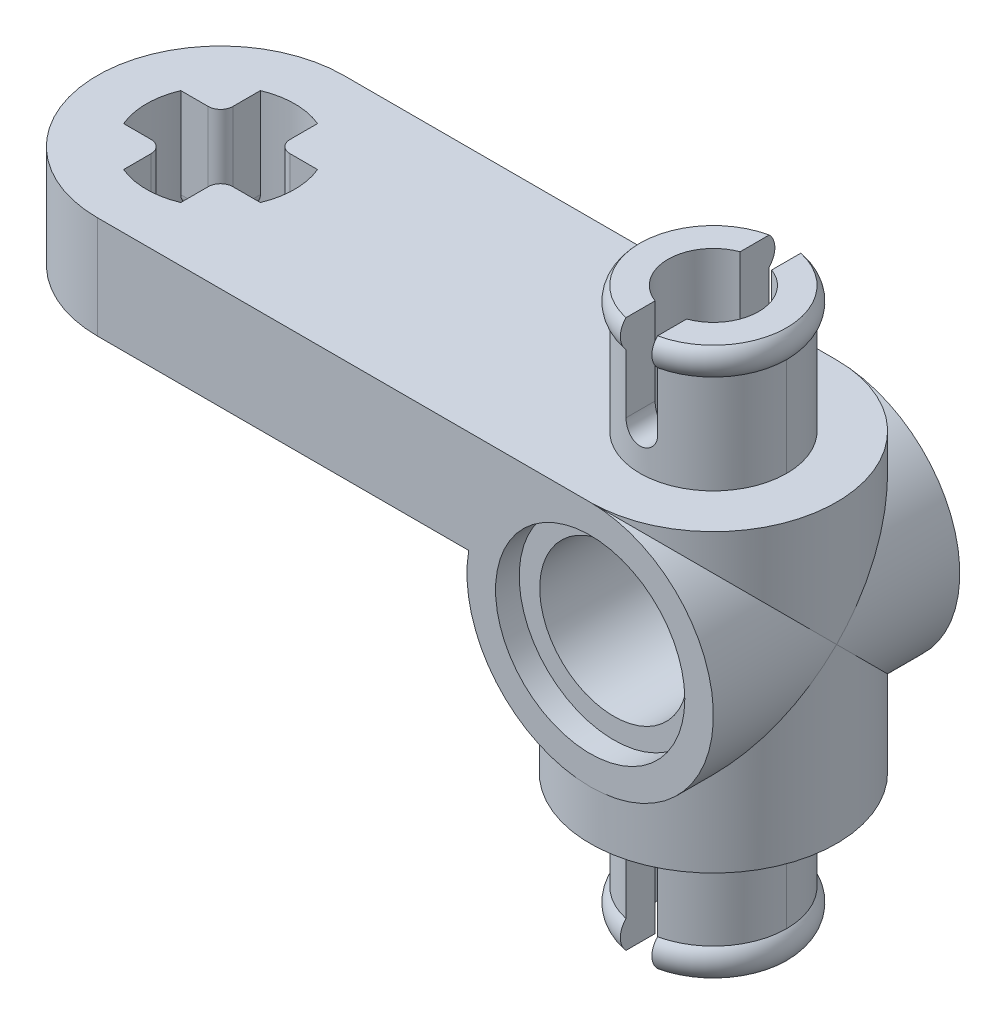
from build123d import *

# Parameters (mm, degrees)
BASE_EXTRUDE_DEPTH       = 1.651
CUT_EXTRUDE4_DEPTH       = 13.977402268
FILLET1_R                = 0.396875
SKETCH8_R                = 3.96875
BOSS_EXTRUDE1_DEPTH      = 9.525
BOSS_EXTRUDE2_DEPTH      = 3.96875
BOSS_EXTRUDE2_DEPTH_BACK = 3.96875
SKETCH9_R                = 3.96875
SKETCH13_R               = 2.3622
BOSS_EXTRUDE3_DEPTH      = 8.8265
CUT_EXTRUDE8_START       = 1.651
CUT_EXTRUDE8_OUTLINE_R   = 1.4605
CUT_EXTRUDE8_DEPTH       = 4.064
CUT_EXTRUDE10_DEPTH      = 18.321247346
CUT_EXTRUDE10_DEPTH_BACK = 18.321247346
CUT_EXTRUDE11_START      = -4.064
SKETCH19_R               = 1.4605
CUT_EXTRUDE11_DEPTH      = 4.064
SKETCH10_R               = 2.3876
CUT_EXTRUDE5_DEPTH       = 19.635410961
SKETCH11_R               = 3.048
CUT_EXTRUDE6_DEPTH       = 0.762
CUT_EXTRUDE7_START       = -0.762
SKETCH12_R               = 3.048
CUT_EXTRUDE7_DEPTH       = 0.762
SKETCH20_W               = 6.400057863
SKETCH20_H               = 4.7625
CUT_EXTRUDE12_DEPTH      = 2.032
BOSS_EXTRUDE4_REACH      = 18.228
SKETCH21_W               = 1.778
SKETCH21_H               = 1.143
SKETCH22_R               = 3.556
SKETCH22_R_2             = 2.3876
BOSS_EXTRUDE5_DEPTH      = 0.127
FILLET2_R                = 0.39624


# Read off the part's stored shape, not the designer's step: Cut-Extrude8
with BuildPart() as part:
    # Sketch1 → Base-Extrude (new, symmetric)
    with BuildSketch(Plane(origin=(0, 0, 0), x_dir=(1, 0, 0), z_dir=(0, 1, 0))):
        with BuildLine():
            Line((-7.9375, 3.96875), (7.9375, 3.96875))
            ThreePointArc((7.9375, 3.96875), (11.90625, 0), (7.9375, -3.96875))
            Line((7.9375, -3.96875), (-7.9375, -3.96875))
            ThreePointArc((-7.9375, -3.96875), (-11.90625, 0), (-7.9375, 3.96875))
        make_face()
    extrude(amount=BASE_EXTRUDE_DEPTH, both=True)

    # Sketch5 → Cut-Extrude4 (cut, through all)
    with BuildSketch(Plane(origin=(0, 1.651, 0), x_dir=(-1, 0, 0), z_dir=(0, 1, 0))):
        with BuildLine():
            Line((7.01675, -2.202919244), (7.01675, -0.92075))
            Line((7.01675, -0.92075), (5.734580756, -0.92075))
            ThreePointArc((5.734580756, -0.92075), (5.5499, 0), (5.734580756, 0.92075))
            Line((5.734580756, 0.92075), (7.01675, 0.92075))
            Line((7.01675, 0.92075), (7.01675, 2.202919244))
            ThreePointArc((7.01675, 2.202919244), (7.9375, 2.3876), (8.85825, 2.202919244))
            Line((8.85825, 2.202919244), (8.85825, 0.92075))
            Line((8.85825, 0.92075), (10.140419244, 0.92075))
            ThreePointArc((10.140419244, 0.92075), (10.3251, 0), (10.140419244, -0.92075))
            Line((10.140419244, -0.92075), (8.85825, -0.92075))
            Line((8.85825, -0.92075), (8.85825, -2.202919244))
            ThreePointArc((8.85825, -2.202919244), (7.9375, -2.3876), (7.01675, -2.202919244))
        make_face()
    extrude(amount=-CUT_EXTRUDE4_DEPTH, mode=Mode.SUBTRACT)

    # Fillet1
    fillet1_edges = [part.edges().sort_by_distance(p)[0] for p in [
        (-7.01675, 0, 0.92075),
        (-8.85825, 0, 0.92075),
        (-8.85825, 0, -0.92075),
        (-7.01675, 0, -0.92075),
    ]]
    fillet(fillet1_edges, radius=FILLET1_R)

    # Sketch8 → Boss-Extrude1 (add)
    with BuildSketch(Plane.XZ.offset(-1.651)):
        with Locations(Location((7.9375, 0, 0), (0, 0, 270))):
            Circle(SKETCH8_R)
    extrude(amount=BOSS_EXTRUDE1_DEPTH)

    # Sketch9 → Boss-Extrude2 (add, two sides: drawn at the far end of the back side and taken through both)
    with BuildSketch(Plane.XY.offset(-BOSS_EXTRUDE2_DEPTH_BACK)):
        with Locations((7.9375, -2.31775)):
            Circle(SKETCH9_R)
    extrude(amount=BOSS_EXTRUDE2_DEPTH + BOSS_EXTRUDE2_DEPTH_BACK)

    # Sketch13 → Boss-Extrude3 (add, symmetric)
    with BuildSketch(Plane(origin=(0, -3.1115, 0), x_dir=(-1, 0, 0), z_dir=(0, 1, 0))):
        with Locations(Location((-7.9375, 0, 0), (0, 0, 270))):
            Circle(SKETCH13_R)
    extrude(amount=BOSS_EXTRUDE3_DEPTH, both=True)

    # Sketch15 → Boss-Revolve1 (revolve)
    with BuildSketch(Plane.XY):
        with BuildLine():
            Line((10.2997, 5.715), (10.2997, 4.826))
            ThreePointArc((10.2997, 4.826), (10.4775, 5.2705), (10.2997, 5.715))
        make_face()
    boss_revolve1 = revolve(axis=Axis((7.9375, -2.31775, 0), (0, 1, 0)))

    # Cut-Extrude8 outline → Cut-Extrude8 (cut)
    with BuildSketch(Plane(origin=(0, 0, 0), x_dir=(1, 0, 0), z_dir=(0, 1, 0)).offset(CUT_EXTRUDE8_START)):
        with Locations((7.9375, 0)):
            Circle(CUT_EXTRUDE8_OUTLINE_R)
    extrude(amount=CUT_EXTRUDE8_DEPTH, mode=Mode.SUBTRACT)

    # Sketch18 → Cut-Extrude10 (cut, two sides: drawn at the far end of the back side and taken through both)
    with BuildSketch(Plane.XY.offset(-CUT_EXTRUDE10_DEPTH_BACK)):
        with BuildLine():
            Line((8.4455, 5.715), (8.4455, 2.921))
            ThreePointArc((8.4455, 2.921), (7.9375, 2.413), (7.4295, 2.921))
            Line((7.4295, 2.921), (7.4295, 5.715))
            Line((7.4295, 5.715), (8.4455, 5.715))
        make_face()
    cut_extrude10 = extrude(amount=CUT_EXTRUDE10_DEPTH + CUT_EXTRUDE10_DEPTH_BACK, mode=Mode.SUBTRACT)

    # Mirror1: Boss-Revolve1, Cut-Extrude10 across Plane1
    add(boss_revolve1.mirror(Plane(origin=(0, -3.1115, 0), x_dir=(-1, 0, 0), z_dir=(0, 1, 0))))
    add(cut_extrude10.mirror(Plane(origin=(0, -3.1115, 0), x_dir=(-1, 0, 0), z_dir=(0, 1, 0))), mode=Mode.SUBTRACT)

    # Sketch19 → Cut-Extrude11 (cut)
    with BuildSketch(Plane.XZ.offset(11.938).offset(CUT_EXTRUDE11_START)):
        with Locations(Location((7.9375, 0, 0), (0, 0, 90))):
            Circle(SKETCH19_R)
    extrude(amount=CUT_EXTRUDE11_DEPTH, mode=Mode.SUBTRACT)

    # Sketch10 → Cut-Extrude5 (cut, through all)
    with BuildSketch(Plane.XY.offset(3.96875)):
        with Locations((7.9375, -2.31775)):
            Circle(SKETCH10_R)
    extrude(amount=-CUT_EXTRUDE5_DEPTH, mode=Mode.SUBTRACT)

    # Sketch11 → Cut-Extrude6 (cut)
    with BuildSketch(Plane.XY.offset(3.96875)):
        with Locations((7.9375, -2.31775)):
            Circle(SKETCH11_R)
    extrude(amount=-CUT_EXTRUDE6_DEPTH, mode=Mode.SUBTRACT)

    # Sketch12 → Cut-Extrude7 (cut)
    with BuildSketch(Plane(origin=(0, 0, -3.96875), x_dir=(-1, 0, 0), z_dir=(0, 0, -1)).offset(CUT_EXTRUDE7_START)):
        with Locations(Location((-7.9375, -2.31775, 0), (0, 0, 180))):
            Circle(SKETCH12_R)
    extrude(amount=CUT_EXTRUDE7_DEPTH, mode=Mode.SUBTRACT)

    # Sketch20 → Cut-Extrude12 (cut)
    with BuildSketch(Plane.XZ.offset(1.651)):
        with Locations((-0.762371069, 0)):
            Rectangle(SKETCH20_W, SKETCH20_H)
    extrude(amount=-CUT_EXTRUDE12_DEPTH, mode=Mode.SUBTRACT)

    # Sketch21 → Boss-Extrude4 (add, up to next)
    with BuildSketch(Plane.XZ.offset(1.651), mode=Mode.PRIVATE) as boss_extrude4_sk1:
        with Locations((-3.0734, 0)):
            Rectangle(SKETCH21_W, SKETCH21_H)
    boss_extrude4_tool1 = extrude(boss_extrude4_sk1.sketch, amount=-BOSS_EXTRUDE4_REACH, mode=Mode.PRIVATE) - part.part
    add(boss_extrude4_tool1.solids().sort_by_distance((-3.0734, -1.651, 0))[0])

    # Sketch22 → Boss-Extrude5 (add)
    with BuildSketch(Plane.XZ.offset(1.651)):
        with Locations(Location((-7.9375, 0, 0), (0, 0, 270))):
            Circle(SKETCH22_R)
        with Locations(Location((-7.9375, 0, 0), (0, 0, 112.68337229))):
            Circle(SKETCH22_R_2, mode=Mode.SUBTRACT)
    extrude(amount=BOSS_EXTRUDE5_DEPTH)

    # Fillet2
    # the kernel refuses this fillet: 0.39624 mm, written as the material it takes off along each edge
    with BuildSketch(Plane(origin=(-7.01675, -1.651, 3.193519244), x_dir=(0, 1, 0), z_dir=(0, 0, -1))) as fillet2_piece_1_section:
        with BuildLine():
            CenterArc((FILLET2_R, FILLET2_R), FILLET2_R, 180, 90)
            Line((0, FILLET2_R), (0, 0))
            Line((0, 0), (FILLET2_R, 0))
        make_face()
    fillet2_piece_1 = extrude(amount=1.875894244, mode=Mode.PRIVATE)
    fillet2_piece_1 = fillet2_piece_1 & Plane(origin=(-7.9375, -1.553010316, 0), x_dir=(-0.3856382978723408, 0, -0.9226500437403793), z_dir=(0, 1, 0)) * Cylinder(2.3876, 6, mode=Mode.PRIVATE)
    add(fillet2_piece_1, mode=Mode.SUBTRACT)
    with BuildSketch(Plane(origin=(-8.85825, -1.651, -3.193519244), x_dir=(0, 1, 0), z_dir=(0, 0, 1))) as fillet2_piece_2_section:
        with BuildLine():
            CenterArc((FILLET2_R, FILLET2_R), FILLET2_R, 180, 90)
            Line((0, FILLET2_R), (0, 0))
            Line((0, 0), (FILLET2_R, 0))
        make_face()
    fillet2_piece_2 = extrude(amount=1.875894244, mode=Mode.PRIVATE)
    fillet2_piece_2 = fillet2_piece_2 & Plane(origin=(-7.9375, -1.553010324, 0), x_dir=(-0.3856382978723408, 0, -0.9226500437403793), z_dir=(0, 1, 0)) * Cylinder(2.3876, 6, mode=Mode.PRIVATE)
    add(fillet2_piece_2, mode=Mode.SUBTRACT)
    with BuildSketch(Plane(origin=(-8.85825, -1.651, 1.317625), x_dir=(0, 1, 0), z_dir=(0, 0, 1))) as fillet2_piece_3_section:
        with BuildLine():
            CenterArc((FILLET2_R, FILLET2_R), FILLET2_R, 180, 90)
            Line((0, FILLET2_R), (0, 0))
            Line((0, 0), (FILLET2_R, 0))
        make_face()
    fillet2_piece_3 = extrude(amount=1.875894244, mode=Mode.PRIVATE)
    fillet2_piece_3 = fillet2_piece_3 & Plane(origin=(-7.9375, -1.553010463, 0), x_dir=(-0.3856382978723408, 0, -0.9226500437403793), z_dir=(0, 1, 0)) * Cylinder(2.3876, 6, mode=Mode.PRIVATE)
    add(fillet2_piece_3, mode=Mode.SUBTRACT)
    with BuildSketch(Plane(origin=(-7.01675, -1.651, -1.317625), x_dir=(0, 1, 0), z_dir=(0, 0, -1))) as fillet2_piece_4_section:
        with BuildLine():
            CenterArc((FILLET2_R, FILLET2_R), FILLET2_R, 180, 90)
            Line((0, FILLET2_R), (0, 0))
            Line((0, 0), (FILLET2_R, 0))
        make_face()
    fillet2_piece_4 = extrude(amount=1.875894244, mode=Mode.PRIVATE)
    fillet2_piece_4 = fillet2_piece_4 & Plane(origin=(-7.9375, -1.553010297, 0), x_dir=(-0.3856382978723408, 0, -0.9226500437403793), z_dir=(0, 1, 0)) * Cylinder(2.3876, 6, mode=Mode.PRIVATE)
    add(fillet2_piece_4, mode=Mode.SUBTRACT)
    with BuildSketch(Plane(origin=(-9.255125, -1.651, -0.92075), x_dir=(0, 1, 0), z_dir=(-1, 0, 0))) as fillet2_piece_5_section:
        with BuildLine():
            CenterArc((FILLET2_R, FILLET2_R), FILLET2_R, 180, 90)
            Line((0, FILLET2_R), (0, 0))
            Line((0, 0), (FILLET2_R, 0))
        make_face()
    fillet2_piece_5 = extrude(amount=1.875894244, mode=Mode.PRIVATE)
    fillet2_piece_5 = fillet2_piece_5 & Plane(origin=(-7.9375, -1.553010453, 0), x_dir=(-0.3856382978723408, 0, -0.9226500437403793), z_dir=(0, 1, 0)) * Cylinder(2.3876, 6, mode=Mode.PRIVATE)
    add(fillet2_piece_5, mode=Mode.SUBTRACT)
    with BuildSketch(Plane(origin=(-6.619875, -1.651, 0.92075), x_dir=(0, 1, 0), z_dir=(1, 0, 0))) as fillet2_piece_6_section:
        with BuildLine():
            CenterArc((FILLET2_R, FILLET2_R), FILLET2_R, 180, 90)
            Line((0, FILLET2_R), (0, 0))
            Line((0, 0), (FILLET2_R, 0))
        make_face()
    fillet2_piece_6 = extrude(amount=1.875894244, mode=Mode.PRIVATE)
    fillet2_piece_6 = fillet2_piece_6 & Plane(origin=(-7.9375, -1.553010452, 0), x_dir=(-0.3856382978723408, 0, -0.9226500437403793), z_dir=(0, 1, 0)) * Cylinder(2.3876, 6, mode=Mode.PRIVATE)
    add(fillet2_piece_6, mode=Mode.SUBTRACT)
    with BuildSketch(Plane(origin=(-4.743980756, -1.651, -0.92075), x_dir=(0, 1, 0), z_dir=(-1, 0, 0))) as fillet2_piece_7_section:
        with BuildLine():
            CenterArc((FILLET2_R, FILLET2_R), FILLET2_R, 180, 90)
            Line((0, FILLET2_R), (0, 0))
            Line((0, 0), (FILLET2_R, 0))
        make_face()
    fillet2_piece_7 = extrude(amount=1.875894244, mode=Mode.PRIVATE)
    fillet2_piece_7 = fillet2_piece_7 & Plane(origin=(-7.9375, -1.553010465, 0), x_dir=(-0.3856382978723408, 0, -0.9226500437403793), z_dir=(0, 1, 0)) * Cylinder(2.3876, 6, mode=Mode.PRIVATE)
    add(fillet2_piece_7, mode=Mode.SUBTRACT)
    with BuildSketch(Plane(origin=(-11.131019244, -1.651, 0.92075), x_dir=(0, 1, 0), z_dir=(1, 0, 0))) as fillet2_piece_8_section:
        with BuildLine():
            CenterArc((FILLET2_R, FILLET2_R), FILLET2_R, 180, 90)
            Line((0, FILLET2_R), (0, 0))
            Line((0, 0), (FILLET2_R, 0))
        make_face()
    fillet2_piece_8 = extrude(amount=1.875894244, mode=Mode.PRIVATE)
    fillet2_piece_8 = fillet2_piece_8 & Plane(origin=(-7.9375, -1.553010316, 0), x_dir=(-0.3856382978723408, 0, -0.9226500437403793), z_dir=(0, 1, 0)) * Cylinder(2.3876, 6, mode=Mode.PRIVATE)
    add(fillet2_piece_8, mode=Mode.SUBTRACT)
    with BuildSketch(Plane(origin=(-6.619875, -1.651, 1.317625), x_dir=(0, 0, -1), z_dir=(1, 0, 0))) as fillet2_piece_9:
        with BuildLine():
            CenterArc((0.396875 - FILLET2_R, FILLET2_R), FILLET2_R, 270, 90)
            Line((0.396875 - FILLET2_R, 0), (0.396875, 0))
            Line((0.396875, 0), (0.396875, FILLET2_R))
        make_face()
    revolve(axis=Axis((-6.619875, -1.651, 1.317625), (0, 1, 0)), revolution_arc=90, mode=Mode.SUBTRACT)
    with BuildSketch(Plane(origin=(-9.255125, -1.651, 1.317625), x_dir=(1, 0, 0), z_dir=(0, 0, 1))) as fillet2_piece_10:
        with BuildLine():
            CenterArc((0.396875 - FILLET2_R, FILLET2_R), FILLET2_R, 270, 90)
            Line((0.396875 - FILLET2_R, 0), (0.396875, 0))
            Line((0.396875, 0), (0.396875, FILLET2_R))
        make_face()
    revolve(axis=Axis((-9.255125, -1.651, 1.317625), (0, 1, 0)), revolution_arc=90, mode=Mode.SUBTRACT)
    with BuildSketch(Plane(origin=(-6.619875, -1.651, -1.317625), x_dir=(0, 0, 1), z_dir=(1, 0, 0))) as fillet2_piece_11:
        with BuildLine():
            CenterArc((0.396875 - FILLET2_R, -FILLET2_R), FILLET2_R, 0, 90)
            Line((0.396875 - FILLET2_R, 0), (0.396875, 0))
            Line((0.396875, 0), (0.396875, -FILLET2_R))
        make_face()
    revolve(axis=Axis((-6.619875, -1.651, -1.317625), (0, -1, 0)), revolution_arc=90, mode=Mode.SUBTRACT)
    with BuildSketch(Plane(origin=(-9.255125, -1.651, -1.317625), x_dir=(0, 0, 1), z_dir=(-1, 0, 0))) as fillet2_piece_12:
        with BuildLine():
            CenterArc((0.396875 - FILLET2_R, FILLET2_R), FILLET2_R, 270, 90)
            Line((0.396875 - FILLET2_R, 0), (0.396875, 0))
            Line((0.396875, 0), (0.396875, FILLET2_R))
        make_face()
    revolve(axis=Axis((-9.255125, -1.651, -1.317625), (0, 1, 0)), revolution_arc=90, mode=Mode.SUBTRACT)


solid = part.part
